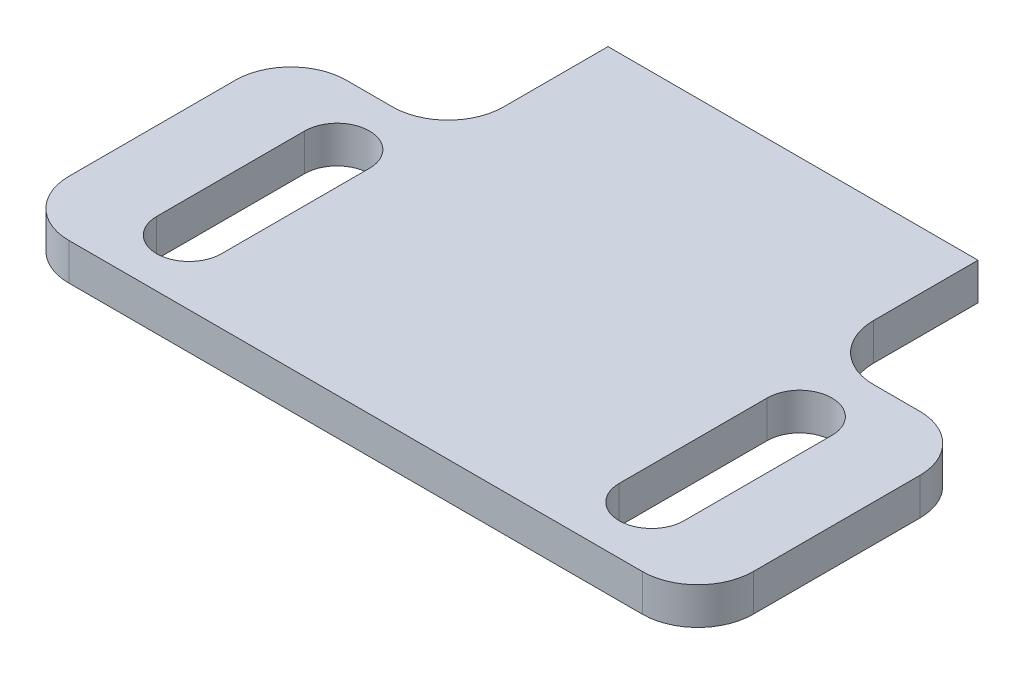
from build123d import *

# Parameters (mm, degrees)
SM_BASE_FLANGE_1_DEPTH = 2
FILLET_1_R             = 3
CUT_EXTRUDE_1_DEPTH    = 10


# Sheet-metal steps are written as plain solids
with BuildPart() as part:
    # Sketch 1 → 基体-法兰1 (new body)
    with BuildSketch(Plane(origin=(0, 0, 0), x_dir=(1, 0, 0), z_dir=(0, 1, 0))):
        Polygon((-10, 7.5), (-18.5, 7.5), (-18.5, -7.5), (18.5, -7.5), (18.5, 7.5), (10, 7.5), (10, 16.146039932), (-10, 16.146039932), align=None)
    extrude(amount=-SM_BASE_FLANGE_1_DEPTH)

    # 圆角1
    fillet_1_edges = [part.edges().sort_by_distance(p)[0] for p in [
        (18.5, -1, -7.5),
        (18.5, -1, 7.5),
        (-18.5, -1, 7.5),
        (-18.5, -1, -7.5),
        (-10, -1, -7.5),
        (10, -1, -7.5),
    ]]
    fillet(fillet_1_edges, radius=FILLET_1_R)

    # 草图6 → 切除-拉伸1 (cut)
    with BuildSketch(Plane.XZ.offset(2)):
        with BuildLine():
            Line((-10.75, 4), (-10.75, -4))
            ThreePointArc((-10.75, -4), (-12.5, -5.75), (-14.25, -4))
            Line((-14.25, -4), (-14.25, 4))
            ThreePointArc((-14.25, 4), (-12.5, 5.75), (-10.75, 4))
        make_face()
        with BuildLine():
            Line((14.25, 4), (14.25, -4))
            ThreePointArc((14.25, -4), (12.5, -5.75), (10.75, -4))
            Line((10.75, -4), (10.75, 4))
            ThreePointArc((10.75, 4), (12.5, 5.75), (14.25, 4))
        make_face()
    extrude(amount=-CUT_EXTRUDE_1_DEPTH, mode=Mode.SUBTRACT)


solid = part.part
